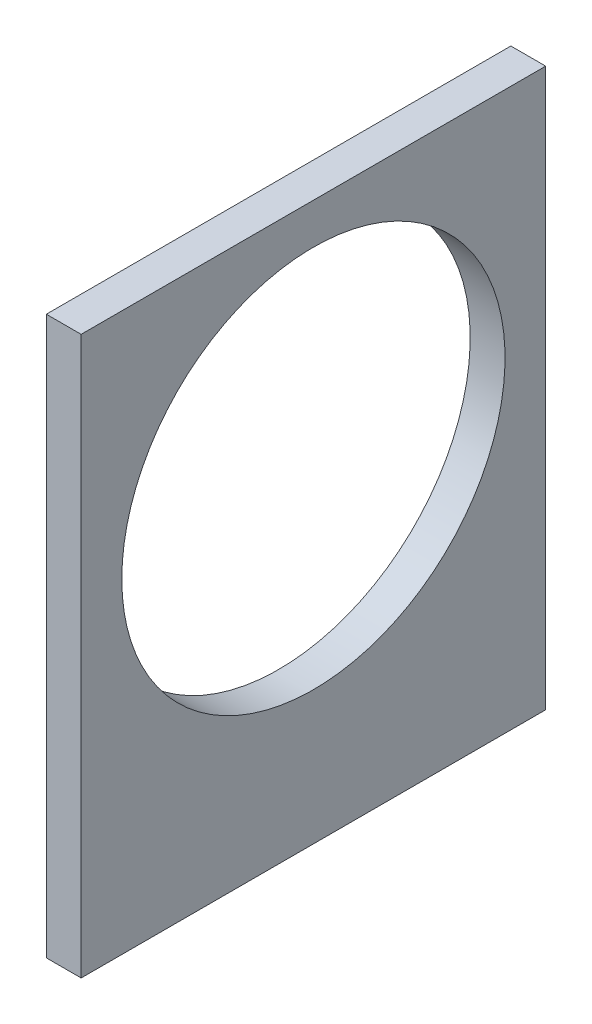
from build123d import *

# Parameters (mm, degrees)
SKETCH4_W                 = 63.5
SKETCH4_H                 = 76.2
SKETCH4_R                 = 26.19375
BOSS_EXTRUDE2_DEPTH       = 4.7625
F_6_32_TAPPED_HOLE3_D     = 2.7051
F_6_32_TAPPED_HOLE3_DEPTH = 16.6624
F_6_32_TAPPED_HOLE3_TIP   = 0.81269403


with BuildPart() as part:
    # Sketch4 → Boss-Extrude2 (new body)
    with BuildSketch(Plane(origin=(0, 0, 0), x_dir=(0, 0, -1), z_dir=(1, 0, 0))):
        Rectangle(SKETCH4_W, SKETCH4_H)
        with Locations((0, 6.35)):
            Circle(SKETCH4_R, mode=Mode.SUBTRACT)
    extrude(amount=BOSS_EXTRUDE2_DEPTH)

    # #6-32 Tapped Hole3
    with Locations(Plane(origin=(0, -38.1, 0), x_dir=(-1, 0, 0), z_dir=(0, -1, 0))):
        with Locations((-2.38125, -28.575), (-2.38125, 28.575)):
            Hole(F_6_32_TAPPED_HOLE3_D / 2, depth=F_6_32_TAPPED_HOLE3_DEPTH)
            with Locations((0, 0, -(F_6_32_TAPPED_HOLE3_DEPTH + F_6_32_TAPPED_HOLE3_TIP / 2))):  # 118° drill point
                Cone(0, F_6_32_TAPPED_HOLE3_D / 2, F_6_32_TAPPED_HOLE3_TIP, mode=Mode.SUBTRACT)


solid = part.part
